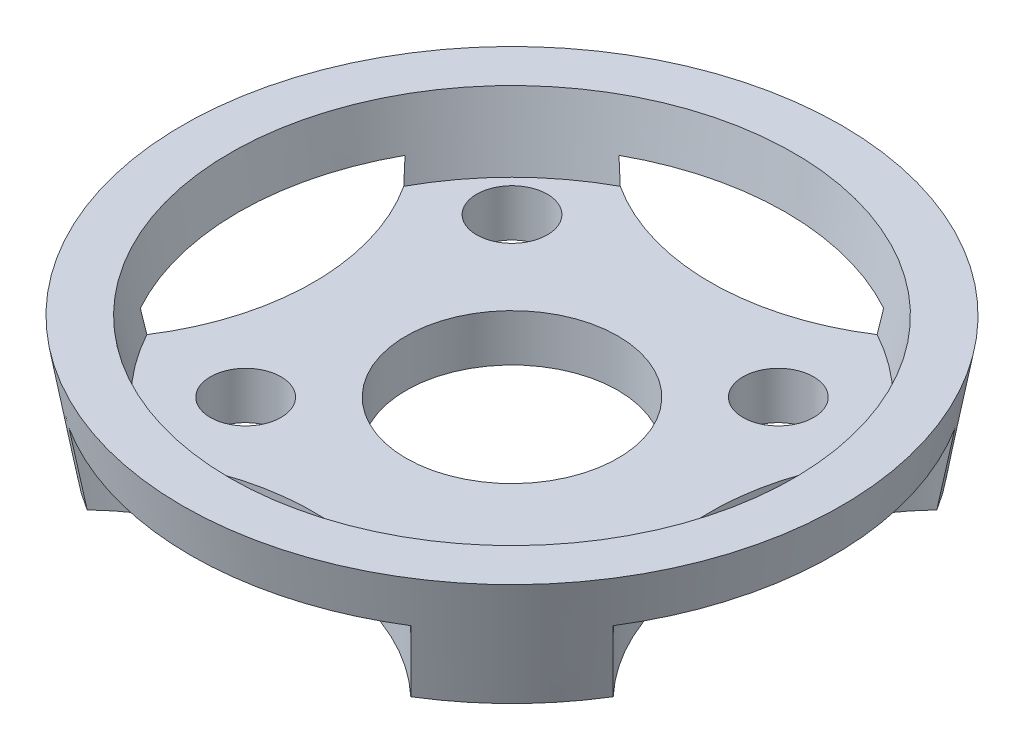
from build123d import *

# Parameters (mm, degrees)
IZIM1_R                     = 14
Y_KSEKLIK_EKSTR_ZYON1_DEPTH = 5
PAH1_SIZE                   = 5
PAH1_SIZE_2                 = 0.881634904
BO_ALTMA1_T                 = -2
IZIM2_R                     = 4.5
KES_EKSTR_ZYON1_DEPTH       = 3
KES_EKSTR_ZYON2_REACH       = 22.421
IZIM3_R                     = 1.5


with BuildPart() as part:
    # Çizim1 → Yükseklik-Ekstrüzyon1 (new body)
    with BuildSketch(Plane(origin=(0, 0, 0), x_dir=(1, 0, 0), z_dir=(0, 1, 0))):
        with Locations(Location((0, 0, 0), (0, 0, 270))):
            Circle(IZIM1_R)
    extrude(amount=Y_KSEKLIK_EKSTR_ZYON1_DEPTH)

    # Pah1
    # the kernel refuses this chamfer: 5, 0.881634904 mm, written as the material it takes off along each edge
    with BuildSketch(Plane(origin=(0, 0, 0), x_dir=(0, 0, 1), z_dir=(-1, 0, 0))) as pah1_piece_1:
        Polygon((14, PAH1_SIZE), (14 - PAH1_SIZE_2, 0), (14, 0), align=None)
    revolve(axis=Axis((0, 0, 0), (0, 1, 0)), mode=Mode.SUBTRACT)

    # İç Boşaltma1
    bo_altma1_openings = [part.faces().sort_by_distance(p)[0] for p in [
        (0, 5, 0),
    ]]
    offset(amount=BO_ALTMA1_T, openings=bo_altma1_openings, kind=Kind.INTERSECTION)

    # Çizim2 → Kes-Ekstrüzyon1 (cut)
    with BuildSketch(Plane.XZ):
        with BuildLine():
            ThreePointArc((-7.5, 11.821590418), (0, 8.435968695), (7.5, 11.821590418))
            ThreePointArc((7.5, 11.821590418), (0, 14), (-7.5, 11.821590418))
        make_face()
        with Locations(Location((0, 0, 0), (0, 0, 270))):
            Circle(IZIM2_R)
        with BuildLine():
            ThreePointArc((11.821590418, -7.5), (14, 0), (11.821590418, 7.5))
            ThreePointArc((11.821590418, 7.5), (8.435968695, 0), (11.821590418, -7.5))
        make_face()
        with BuildLine():
            ThreePointArc((-7.5, -11.821590418), (0, -14), (7.5, -11.821590418))
            ThreePointArc((7.5, -11.821590418), (0, -8.435968695), (-7.5, -11.821590418))
        make_face()
        with BuildLine():
            ThreePointArc((-11.821590418, 7.5), (-14, 0), (-11.821590418, -7.5))
            ThreePointArc((-11.821590418, -7.5), (-8.435968695, 0), (-11.821590418, 7.5))
        make_face()
    extrude(amount=-KES_EKSTR_ZYON1_DEPTH, mode=Mode.SUBTRACT)

    # Çizim3 → Kes-Ekstrüzyon2 (cut, up to next)
    with BuildSketch(Plane.XZ, mode=Mode.PRIVATE) as kes_ekstr_zyon2_sk1:
        with Locations(Location((-5.656854249, 5.656854249, 0), (0, 0, 270))):
            Circle(IZIM3_R)
    kes_ekstr_zyon2_tool1 = extrude(kes_ekstr_zyon2_sk1.sketch, amount=-KES_EKSTR_ZYON2_REACH, mode=Mode.PRIVATE) & part.part
    # Çizim3 → Kes-Ekstrüzyon2 (cut, up to next)
    with BuildSketch(Plane.XZ, mode=Mode.PRIVATE) as kes_ekstr_zyon2_sk2:
        with Locations(Location((6.717514421, 6.717514421, 0), (0, 0, 270))):
            Circle(IZIM3_R)
    kes_ekstr_zyon2_tool2 = extrude(kes_ekstr_zyon2_sk2.sketch, amount=-KES_EKSTR_ZYON2_REACH, mode=Mode.PRIVATE) & part.part
    # Çizim3 → Kes-Ekstrüzyon2 (cut, up to next)
    with BuildSketch(Plane.XZ, mode=Mode.PRIVATE) as kes_ekstr_zyon2_sk3:
        with Locations(Location((5.656854249, -5.656854249, 0), (0, 0, 270))):
            Circle(IZIM3_R)
    kes_ekstr_zyon2_tool3 = extrude(kes_ekstr_zyon2_sk3.sketch, amount=-KES_EKSTR_ZYON2_REACH, mode=Mode.PRIVATE) & part.part
    # Çizim3 → Kes-Ekstrüzyon2 (cut, up to next)
    with BuildSketch(Plane.XZ, mode=Mode.PRIVATE) as kes_ekstr_zyon2_sk4:
        with Locations(Location((-6.717514421, -6.717514421, 0), (0, 0, 270))):
            Circle(IZIM3_R)
    kes_ekstr_zyon2_tool4 = extrude(kes_ekstr_zyon2_sk4.sketch, amount=-KES_EKSTR_ZYON2_REACH, mode=Mode.PRIVATE) & part.part
    add(kes_ekstr_zyon2_tool1.solids().sort_by_distance((-5.656854, 0, 5.656854))[0], mode=Mode.SUBTRACT)
    add(kes_ekstr_zyon2_tool2.solids().sort_by_distance((6.717514, 0, 6.717514))[0], mode=Mode.SUBTRACT)
    add(kes_ekstr_zyon2_tool3.solids().sort_by_distance((5.656854, 0, -5.656854))[0], mode=Mode.SUBTRACT)
    add(kes_ekstr_zyon2_tool4.solids().sort_by_distance((-6.717514, 0, -6.717514))[0], mode=Mode.SUBTRACT)


solid = part.part
